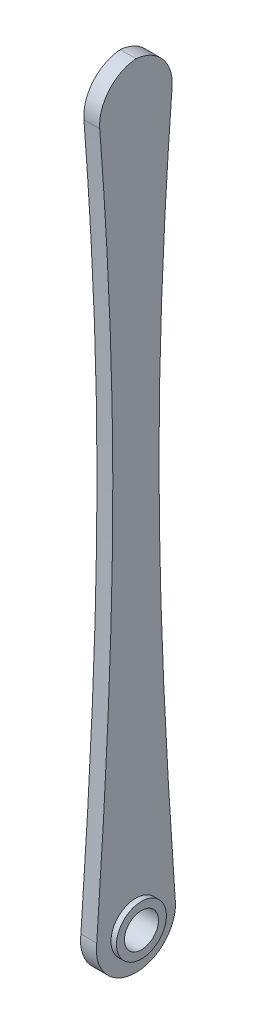
from build123d import *

# Parameters (mm, degrees)
SKETCH1_W           = 2
SKETCH1_H           = 10
BOSS_EXTRUDE1_DEPTH = 100
SKETCH3_R           = 2.15
CUT_EXTRUDE1_DEPTH  = 90
FILLET1_R           = 5
CUT_EXTRUDE2_DEPTH  = 90
FILLET2_R           = 5
BOSS_EXTRUDE2_START = 0.7
SKETCH5_R           = 3.15
SKETCH5_R_2         = 2.15
BOSS_EXTRUDE2_DEPTH = 0.7


# Some blends are built 0.0001 mm under size
with BuildPart() as part:
    # Sketch1 → Boss-Extrude1 (new body)
    with BuildSketch(Plane(origin=(0, 0, 0), x_dir=(1, 0, 0), z_dir=(0, 1, 0))):
        with Locations((1, 5)):
            Rectangle(SKETCH1_W, SKETCH1_H)
    extrude(amount=BOSS_EXTRUDE1_DEPTH)

    # Sketch3 → Cut-Extrude1 (cut)
    with BuildSketch(Plane(origin=(2, 0, 0), x_dir=(0, 0, -1), z_dir=(1, 0, 0))):
        with Locations((5, 5)):
            Circle(SKETCH3_R)
    extrude(amount=-CUT_EXTRUDE1_DEPTH, mode=Mode.SUBTRACT)

    # Fillet1
    fillet1_edges = [part.edges().sort_by_distance(p)[0] for p in [
        (1, 0, -10),
        (1, 0, 0),
    ]]
    fillet(fillet1_edges, radius=FILLET1_R - 0.0001)  # a hair under: the kernel refuses the full size

    # Sketch4 → Cut-Extrude2 (cut)
    with BuildSketch(Plane.ZY):
        with BuildLine():
            add(Edge.make_bspline(
                [(-10, 5), (-7.336619142, 42.407665675), (-7.11394722, 65.464300782), (-10, 100)],
                knots=[0, 0, 0, 0, 1, 1, 1, 1], degree=3))
            Line((-10, 100), (-10, 5))
        make_face()
        with BuildLine():
            add(Edge.make_bspline(
                [(0, 5), (-2.663380858, 42.407665675), (-2.88605278, 65.464300782), (0, 100)],
                knots=[0, 0, 0, 0, 1, 1, 1, 1], degree=3))
            Line((0, 100), (0, 5))
        make_face()
    extrude(amount=-CUT_EXTRUDE2_DEPTH, mode=Mode.SUBTRACT)

    # Fillet2
    # the kernel refuses this fillet: 5 mm, written as the material it takes off along each edge
    with BuildSketch(Plane(origin=(2, 100, -10), x_dir=(0, -0.9968008899824262, 0.07992487554099316), z_dir=(-1, 0, 0)), Plane(origin=(0, 100, 0), x_dir=(0, -0.9968008899824262, -0.07992487554099297), z_dir=(1, 0, 0))) as fillet2_piece_1:
        with BuildLine():
            CenterArc((5.416951327, 4.999969042), FILLET2_R, 175.415752406, 94.382624457)
            Line((0.432946877, 5.39959342), (0.333266788, 5.407585907))
            Line((0.333266788, 5.407585907), (-0.099680089, 0.007992488))
            Line((-0.099680089, 0.007992488), (0.000336329, -0.099999434))
            ThreePointArc((0.000336329, -0.099999434), (2.699681925, -0.095355708), (5.399004527, -0.099999381))
            Line((5.399004527, -0.099999381), (5.399356425, 0))
        make_face()
    extrude(amount=2, mode=Mode.SUBTRACT)

    # Sketch5 → Boss-Extrude2 (add)
    with BuildSketch(Plane(origin=(2, 0, 0), x_dir=(0, 0, -1), z_dir=(1, 0, 0)).offset(BOSS_EXTRUDE2_START)):
        with Locations(Location((5, 5, 0), (0, 0, 180))):
            Circle(SKETCH5_R)
        with Locations((5, 5)):
            Circle(SKETCH5_R_2, mode=Mode.SUBTRACT)
    boss_extrude2 = extrude(amount=-BOSS_EXTRUDE2_DEPTH)

    # Mirror1: Boss-Extrude2 across plane
    add(boss_extrude2.mirror(Plane(origin=(1, 0, 0), x_dir=(0, 0, 1), z_dir=(1, 0, 0))))


solid = part.part
